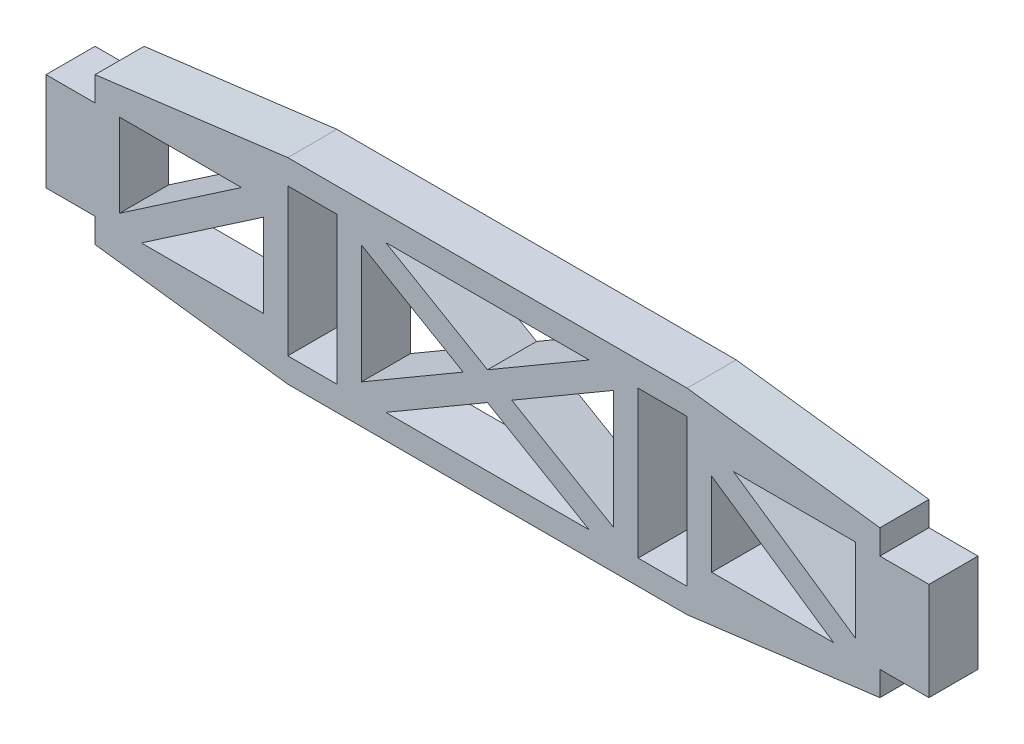
from build123d import *

# Parameters (mm, degrees)
SKETCH1_W           = 6.35
SKETCH1_H           = 19.05
BOSS_EXTRUDE1_DEPTH = 3.175
CUT_EXTRUDE1_DEPTH  = 59.887477446


with BuildPart() as part:
    # Sketch1 → Boss-Extrude1 (new, symmetric)
    with BuildSketch(Plane.XY):
        Polygon((-50.8, -9.525), (-50.8, -6.35), (-57.15, -6.35), (-57.15, 6.35), (-50.8, 6.35), (-50.8, 9.525), (-25.85, 12.7), (25.85, 12.7), (50.8, 9.525), (50.8, 6.35), (57.15, 6.35), (57.15, -6.35), (50.8, -6.35), (50.8, -9.525), (25.85, -12.7), (-25.85, -12.7), align=None)
        with Locations((-22.675, 0)):
            Rectangle(SKETCH1_W, SKETCH1_H, mode=Mode.SUBTRACT)
        with Locations((22.675, 0)):
            Rectangle(SKETCH1_W, SKETCH1_H, mode=Mode.SUBTRACT)
    extrude(amount=BOSS_EXTRUDE1_DEPTH, both=True)

    # Sketch2 → Cut-Extrude1 (cut, through all)
    with BuildSketch(Plane.XY.offset(3.175)):
        Polygon((-31.840276407, 6.35), (-47.625, 6.35), (-47.625, -4.427741378), align=None)
        Polygon((-29.025, 4.427741378), (-44.809723593, -6.35), (-29.025, -6.35), align=None)
        Polygon((-13.174906307, -9.525), (13.174906307, -9.525), (0, -1.837956657), align=None)
        Polygon((3.150093693, 0), (16.325, -7.687043343), (16.325, 7.687043343), align=None)
        Polygon((-16.325, -7.687043343), (-3.150093693, 0), (-16.325, 7.687043343), align=None)
        Polygon((-13.174906307, 9.525), (0, 1.837956657), (13.174906307, 9.525), align=None)
        Polygon((47.625, 6.35), (31.840276407, 6.35), (47.625, -4.427741378), align=None)
        Polygon((44.809723593, -6.35), (29.025, 4.427741378), (29.025, -6.35), align=None)
    extrude(amount=-CUT_EXTRUDE1_DEPTH, mode=Mode.SUBTRACT)


solid = part.part
